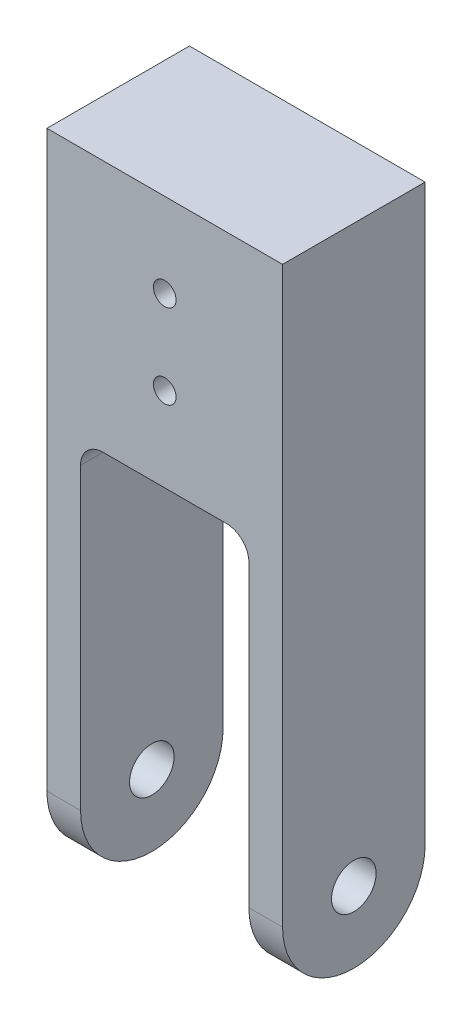
from build123d import *

# Parameters (mm, degrees)
SKETCH_1_W            = 42
SKETCH_1_H            = 25.4
EXTRUDE_1_DEPTH       = 70
SKETCH_5_W            = 6
SKETCH_5_H            = 25.4
EXTRUDE_5_DEPTH       = 70
SKETCH_6_R            = 3.96875
CUT_EXTRUDE_2_DEPTH   = 83.61531335
FILLET_6_R            = 4
HOLE_WIZARD_10_32_1_D = 4.0386
FILLET_7_R            = 12.7
SKETCH_9_W            = 42
SKETCH_9_H            = 25
CUT_EXTRUDE_3_DEPTH   = 78.370278531


with BuildPart() as part:
    # 草圖1 → 填料-伸長1 (new body)
    with BuildSketch(Plane(origin=(0, 0, 0), x_dir=(1, 0, 0), z_dir=(0, 1, 0))):
        Rectangle(SKETCH_1_W, SKETCH_1_H)
    extrude(amount=EXTRUDE_1_DEPTH)

    # 草圖5 → 填料-伸長5 (add)
    with BuildSketch(Plane.XZ):
        with Locations((-18, 0)):
            Rectangle(SKETCH_5_W, SKETCH_5_H)
        with Locations((18, 0)):
            Rectangle(SKETCH_5_W, SKETCH_5_H)
    extrude(amount=EXTRUDE_5_DEPTH)

    # 草圖6 → 除料-伸長2 (cut, through all)
    with BuildSketch(Plane.ZY.offset(21)):
        with Locations((0, -57.3)):
            Circle(SKETCH_6_R)
    extrude(amount=-CUT_EXTRUDE_2_DEPTH, mode=Mode.SUBTRACT)

    # 圓角6
    fillet_6_edges = [part.edges().sort_by_distance(p)[0] for p in [
        (15, 0, 0),
        (-15, 0, 0),
    ]]
    fillet(fillet_6_edges, radius=FILLET_6_R)

    # #10-32 螺紋孔1 (through all)
    with Locations(Plane.XY.offset(12.7)):
        with Locations((0, 30), (0, 15)):
            Hole(HOLE_WIZARD_10_32_1_D / 2)

    # 圓角7
    fillet_7_edges = [part.edges().sort_by_distance(p)[0] for p in [
        (18, -70, 12.7),
        (18, -70, -12.7),
        (-18, -70, 12.7),
        (-18, -70, -12.7),
    ]]
    fillet(fillet_7_edges, radius=FILLET_7_R - 0.0001)  # a hair under: the kernel refuses the full size

    # 草圖9 → 除料-伸長3 (cut, through all)
    with BuildSketch(Plane.XY.offset(12.7)):
        with Locations((0, 57.5)):
            Rectangle(SKETCH_9_W, SKETCH_9_H)
    extrude(amount=-CUT_EXTRUDE_3_DEPTH, mode=Mode.SUBTRACT)


solid = part.part
